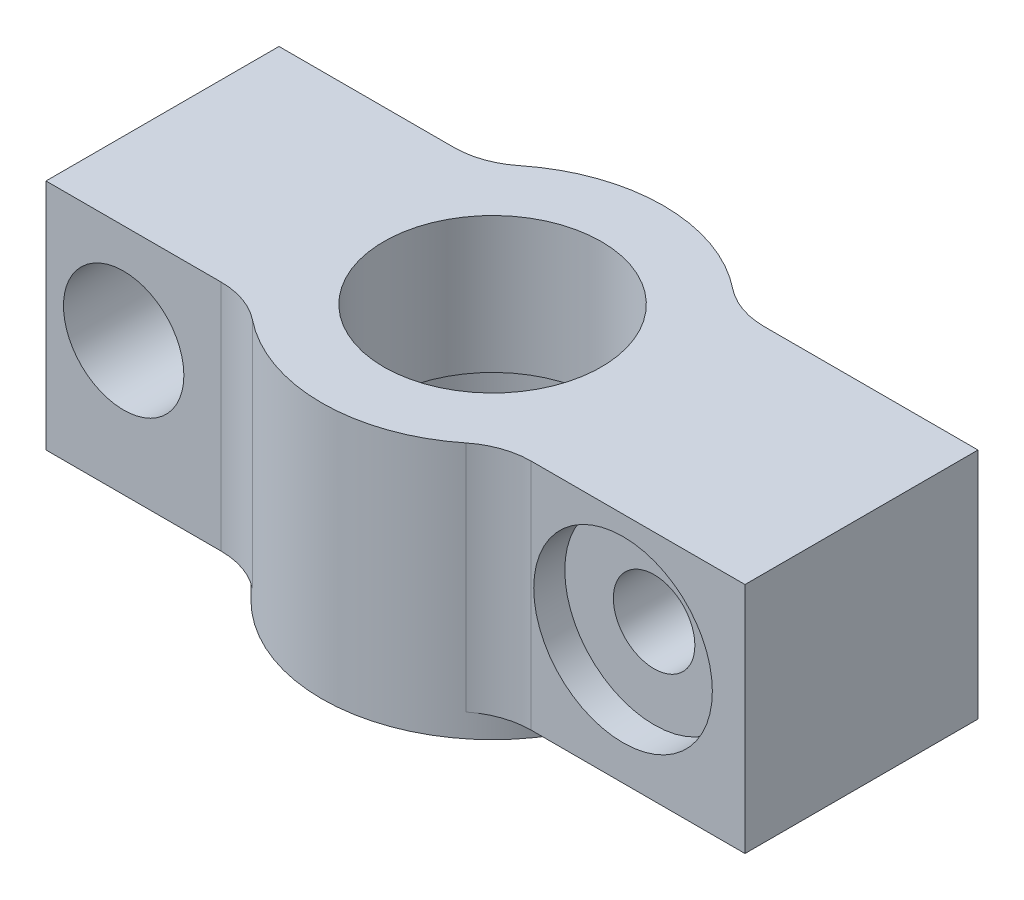
from build123d import *

# Parameters (mm, degrees)
BOSS_EXTRUDE2_DEPTH  = 3
SKETCH3_W            = 20
SKETCH3_H            = 30
BOSS_EXTRUDE5_DEPTH  = 26
SKETCH8_R            = 7.75
CUT_EXTRUDE2_DEPTH   = 36
BOSS_EXTRUDE7_DEPTH  = 27
SKETCH14_R           = 22
BOSS_EXTRUDE8_DEPTH  = 20
SKETCH16_R           = 11.5
CUT_EXTRUDE3_DEPTH   = 4
SKETCH17_R           = 5.25
CUT_EXTRUDE4_DEPTH   = 44
CUT_EXTRUDE5_START   = -4
SKETCH18_R           = 11.5
CUT_EXTRUDE5_DEPTH   = 4
SKETCH24_W           = 6.849841191
SKETCH24_H           = 4
BOSS_EXTRUDE12_DEPTH = 13
SKETCH26_W           = 5
SKETCH26_H           = 30
CUT_EXTRUDE10_DEPTH  = 6
SKETCH27_R           = 22
BOSS_EXTRUDE15_DEPTH = 7
BOSS_EXTRUDE17_DEPTH = 27
SKETCH37_W           = 20
SKETCH37_H           = 30
BOSS_EXTRUDE18_DEPTH = 1
FILLET17_R           = 10
BOSS_EXTRUDE19_START = 3
SKETCH41_R           = 22
BOSS_EXTRUDE19_DEPTH = 3
SKETCH44_W           = 5.842947404
SKETCH44_H           = 4
BOSS_EXTRUDE21_DEPTH = 22
SKETCH46_R           = 16.9
CUT_EXTRUDE11_DEPTH  = 15.5
SKETCH48_R           = 14
CUT_EXTRUDE13_DEPTH  = 25.5
SKETCH49_W           = 5.321549717
SKETCH49_H           = 5
BOSS_EXTRUDE24_DEPTH = 20


with BuildPart() as part:
    # Sketch1 → Boss-Extrude2 (new body)
    with BuildSketch(Plane(origin=(0, 0, 0), x_dir=(1, 0, 0), z_dir=(0, 1, 0))):
        with BuildLine():
            Line((16.093476939, 15), (47.5, 15))
            Line((47.5, 15), (47.5, -15))
            Line((47.5, -15), (16.093476939, -15))
            ThreePointArc((16.093476939, -15), (0, -22), (-16.093476939, -15))
            Line((-16.093476939, -15), (-47.5, -15))
            Line((-47.5, -15), (-47.5, 15))
            Line((-47.5, 15), (-16.093476939, 15))
            ThreePointArc((-16.093476939, 15), (0, 22), (16.093476939, 15))
        make_face()
    extrude(amount=BOSS_EXTRUDE2_DEPTH)

    # Sketch3 → Boss-Extrude5 (add)
    with BuildSketch(Plane(origin=(0, 3, 0), x_dir=(1, 0, 0), z_dir=(0, 1, 0))):
        with Locations((-32.5, 0)):
            Rectangle(SKETCH3_W, SKETCH3_H)
    extrude(amount=BOSS_EXTRUDE5_DEPTH)

    # Sketch8 → Cut-Extrude2 (cut)
    with BuildSketch(Plane.XY.offset(15)):
        with Locations((-32.5, 17.2)):
            Circle(SKETCH8_R)
    extrude(amount=-CUT_EXTRUDE2_DEPTH, mode=Mode.SUBTRACT)

    # Sketch9 → Boss-Extrude7 (add)
    with BuildSketch(Plane(origin=(0, 3, 0), x_dir=(1, 0, 0), z_dir=(0, 1, 0))):
        with BuildLine():
            Line((16.093476939, 15), (47.5, 15))
            Line((47.5, 15), (47.5, -15))
            Line((47.5, -15), (16.093476939, -15))
            ThreePointArc((16.093476939, -15), (22, 0), (16.093476939, 15))
        make_face()
    extrude(amount=BOSS_EXTRUDE7_DEPTH)

    # Sketch14 → Boss-Extrude8 (add)
    with BuildSketch(Plane(origin=(0, 3, 0), x_dir=(1, 0, 0), z_dir=(0, 1, 0))):
        Circle(SKETCH14_R)
    extrude(amount=BOSS_EXTRUDE8_DEPTH)

    # Sketch16 → Cut-Extrude3 (cut)
    with BuildSketch(Plane.XY.offset(15)):
        with Locations((31.79673847, 16)):
            Circle(SKETCH16_R)
    extrude(amount=-CUT_EXTRUDE3_DEPTH, mode=Mode.SUBTRACT)

    # Sketch17 → Cut-Extrude4 (cut)
    with BuildSketch(Plane.XY.offset(11)):
        with Locations((31.79673847, 16)):
            Circle(SKETCH17_R)
    extrude(amount=-CUT_EXTRUDE4_DEPTH, mode=Mode.SUBTRACT)

    # Sketch18 → Cut-Extrude5 (cut)
    with BuildSketch(Plane(origin=(0, 0, -15), x_dir=(-1, 0, 0), z_dir=(0, 0, -1)).offset(CUT_EXTRUDE5_START)):
        with Locations(Location((-31.79673847, 16, 0), (0, 0, 180))):
            Circle(SKETCH18_R)
    extrude(amount=CUT_EXTRUDE5_DEPTH, mode=Mode.SUBTRACT)

    # Sketch24 → Boss-Extrude12 (add)
    with BuildSketch(Plane(origin=(0, 23, 0), x_dir=(1, 0, 0), z_dir=(0, 1, 0))):
        with Locations((17.924920596, 0)):
            Rectangle(SKETCH24_W, SKETCH24_H)
    extrude(amount=-BOSS_EXTRUDE12_DEPTH)

    # Sketch26 → Cut-Extrude10 (cut)
    with BuildSketch(Plane(origin=(0, 3, 0), x_dir=(1, 0, 0), z_dir=(0, 1, 0))):
        with Locations((-45, 0)):
            Rectangle(SKETCH26_W, SKETCH26_H)
    extrude(amount=-CUT_EXTRUDE10_DEPTH, mode=Mode.SUBTRACT)

    # Sketch27 → Boss-Extrude15 (add)
    with BuildSketch(Plane(origin=(0, 23, 0), x_dir=(1, 0, 0), z_dir=(0, 1, 0))):
        Circle(SKETCH27_R)
    extrude(amount=BOSS_EXTRUDE15_DEPTH)

    # Sketch36 → Boss-Extrude17 (add)
    with BuildSketch(Plane(origin=(0, 3, 0), x_dir=(1, 0, 0), z_dir=(0, 1, 0))):
        with BuildLine():
            Line((-16.093476939, -15), (-22.5, -15))
            Line((-22.5, -15), (-22.5, 15))
            Line((-22.5, 15), (-16.093476939, 15))
            ThreePointArc((-16.093476939, 15), (-22, 0), (-16.093476939, -15))
        make_face()
    extrude(amount=BOSS_EXTRUDE17_DEPTH)

    # Sketch37 → Boss-Extrude18 (add)
    with BuildSketch(Plane(origin=(0, 29, 0), x_dir=(1, 0, 0), z_dir=(0, 1, 0))):
        with Locations((-32.5, 0)):
            Rectangle(SKETCH37_W, SKETCH37_H)
    extrude(amount=BOSS_EXTRUDE18_DEPTH)

    # Fillet17
    # the kernel refuses this fillet: 10 mm, written as the material it adds along each edge
    with BuildSketch(Plane(origin=(16.093476939, 3, 15), x_dir=(-0.7334988970942886, 0, 0.67969064136669), z_dir=(0, 1, 0))) as fillet17_piece_1:
        with BuildLine():
            CenterArc((3.949825005, 9.973213236), FILLET17_R, 227.180526604, 38.624832873)
            Line((-2.847081409, 2.638224265), (0, 0))
            ThreePointArc((0, 0), (1.609187965, 0.058930881), (3.21837593, 0))
        make_face()
    extrude(amount=20)
    with BuildSketch(Plane(origin=(-16.093476939, 3, 15), x_dir=(-1, 0, 0), z_dir=(0, 1, 0)), Plane(origin=(16.093476939, 3, -15), x_dir=(1, 0, 0), z_dir=(0, 1, 0))) as fillet17_piece_2:
        with BuildLine():
            CenterArc((3.881507416, 10), FILLET17_R, 231.375167127, 38.624832873)
            ThreePointArc((-2.360675195, 2.1875), (-1.140282829, 1.136975736), (0, 0))
            Line((0, 0), (3.881507416, 0))
        make_face()
    extrude(amount=20)
    with BuildSketch(Plane(origin=(-16.093476939, 3, -15), x_dir=(-1, 0, 0), z_dir=(0, 1, 0))) as fillet17_piece_3:
        with BuildLine():
            CenterArc((3.881507416, -10), FILLET17_R, 90, 38.624832873)
            ThreePointArc((-2.360675195, -2.1875), (-1.140282829, -1.136975736), (0, 0))
            Line((0, 0), (3.881507416, 0))
        make_face()
    extrude(amount=20)
    with BuildSketch(Plane(origin=(16.093476939, 0, -15), x_dir=(1, 0, 0), z_dir=(0, 1, 0)), Plane(origin=(-16.093476939, 0, 15), x_dir=(-1, 0, 0), z_dir=(0, 1, 0))) as fillet17_piece_4:
        with BuildLine():
            CenterArc((3.881507416, 10), FILLET17_R, 231.375167127, 38.624832873)
            ThreePointArc((-2.360675195, 2.1875), (-1.140282829, 1.136975736), (0, 0))
            Line((0, 0), (3.881507416, 0))
        make_face()
    extrude(amount=3)
    with BuildSketch(Plane(origin=(16.093476939, 23, -15), x_dir=(1, 0, 0), z_dir=(0, 1, 0)), Plane(origin=(-16.093476939, 23, 15), x_dir=(-1, 0, 0), z_dir=(0, 1, 0))) as fillet17_piece_5:
        with BuildLine():
            CenterArc((3.881507416, 10), FILLET17_R, 231.375167127, 38.624832873)
            ThreePointArc((-2.360675195, 2.1875), (-1.140282829, 1.136975736), (0, 0))
            Line((0, 0), (3.881507416, 0))
        make_face()
    extrude(amount=7)
    with BuildSketch(Plane(origin=(-16.093476939, 0, -15), x_dir=(0.7334988970942858, 0, -0.6796906413666929), z_dir=(0, 1, 0)), Plane(origin=(16.093476939, 0, 15), x_dir=(-0.7334988970942886, 0, 0.6796906413666898), z_dir=(0, 1, 0))) as fillet17_piece_6:
        with BuildLine():
            CenterArc((3.949825005, 9.973213236), FILLET17_R, 227.180526604, 38.624832873)
            Line((-2.847081409, 2.638224265), (0, 0))
            ThreePointArc((0, 0), (1.609187965, 0.058930881), (3.21837593, 0))
        make_face()
    extrude(amount=3)
    with BuildSketch(Plane(origin=(-16.093476939, 23, -15), x_dir=(-1, 0, 0), z_dir=(0, 1, 0))) as fillet17_piece_7:
        with BuildLine():
            CenterArc((3.881507416, -10), FILLET17_R, 90, 38.624832873)
            ThreePointArc((-2.360675195, -2.1875), (-1.140282829, -1.136975736), (0, 0))
            Line((0, 0), (3.881507416, 0))
        make_face()
    extrude(amount=7)
    with BuildSketch(Plane(origin=(16.093476939, 23, 15), x_dir=(-0.7334988970942886, 0, 0.67969064136669), z_dir=(0, 1, 0))) as fillet17_piece_8:
        with BuildLine():
            CenterArc((3.949825005, 9.973213236), FILLET17_R, 227.180526604, 38.624832873)
            Line((-2.847081409, 2.638224265), (0, 0))
            ThreePointArc((0, 0), (1.609187965, 0.058930881), (3.21837593, 0))
        make_face()
    extrude(amount=7)

    # Sketch41 → Boss-Extrude19 (add)
    with BuildSketch(Plane.XZ.offset(BOSS_EXTRUDE19_START)):
        with Locations(Location((0, 0, 0), (0, 0, 270))):
            Circle(SKETCH41_R)
    extrude(amount=-BOSS_EXTRUDE19_DEPTH)

    # Sketch44 → Boss-Extrude21 (add)
    with BuildSketch(Plane(origin=(0, 30, 0), x_dir=(1, 0, 0), z_dir=(0, 1, 0))):
        with Locations((16.9, 0)):
            Rectangle(SKETCH44_W, SKETCH44_H)
    extrude(amount=-BOSS_EXTRUDE21_DEPTH)

    # Sketch46 → Cut-Extrude11 (cut)
    with BuildSketch(Plane.XZ.offset(3)):
        with Locations(Location((0, 0, 0), (0, 0, 270))):
            Circle(SKETCH46_R)
    extrude(amount=-CUT_EXTRUDE11_DEPTH, mode=Mode.SUBTRACT)

    # Sketch48 → Cut-Extrude13 (cut)
    with BuildSketch(Plane.XZ.offset(-12.5)):
        with Locations(Location((0, 0, 0), (0, 0, 270))):
            Circle(SKETCH48_R)
    extrude(amount=-CUT_EXTRUDE13_DEPTH, mode=Mode.SUBTRACT)

    # Sketch49 → Boss-Extrude24 (add)
    with BuildSketch(Plane(origin=(0, 30, 0), x_dir=(1, 0, 0), z_dir=(0, 1, 0))):
        with Locations((16.690799244, 0)):
            Rectangle(SKETCH49_W, SKETCH49_H)
    extrude(amount=-BOSS_EXTRUDE24_DEPTH)


solid = part.part
